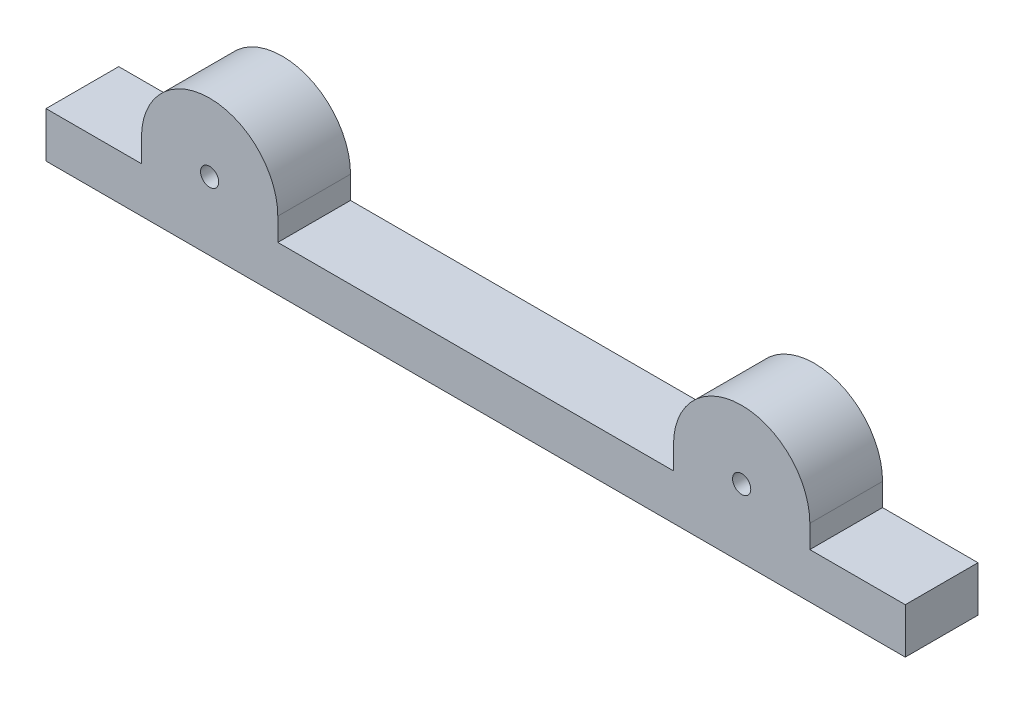
from build123d import *

# Parameters (mm, degrees)
SKETCH1_R           = 0.635
BOSS_EXTRUDE1_DEPTH = 5.08


with BuildPart() as part:
    # Sketch1 → Boss-Extrude1 (new body)
    with BuildSketch(Plane.XY):
        with BuildLine():
            Line((0, 0), (49.86782, 0))
            Line((49.86782, 0), (54.94782, 0))
            Line((54.94782, 0), (54.94782, 3.175))
            Line((54.94782, 3.175), (49.86782, 3.175))
            Line((49.86782, 3.175), (48.28032, 3.175))
            Line((48.28032, 3.175), (48.28032, 4.7625))
            ThreePointArc((48.28032, 4.7625), (43.51782, 9.525), (38.75532, 4.7625))
            Line((38.75532, 4.7625), (38.75532, 3.175))
            Line((38.75532, 3.175), (11.1125, 3.175))
            Line((11.1125, 3.175), (11.1125, 4.7625))
            ThreePointArc((11.1125, 4.7625), (6.35, 9.525), (1.5875, 4.7625))
            Line((1.5875, 4.7625), (1.5875, 3.175))
            Line((1.5875, 3.175), (0, 3.175))
            Line((0, 3.175), (-5.08, 3.175))
            Line((-5.08, 3.175), (-5.08, 0))
            Line((-5.08, 0), (0, 0))
        make_face()
        with Locations((6.35, 4.7625)):
            Circle(SKETCH1_R, mode=Mode.SUBTRACT)
        with Locations((43.51782, 4.7625)):
            Circle(SKETCH1_R, mode=Mode.SUBTRACT)
    extrude(amount=BOSS_EXTRUDE1_DEPTH)


solid = part.part
